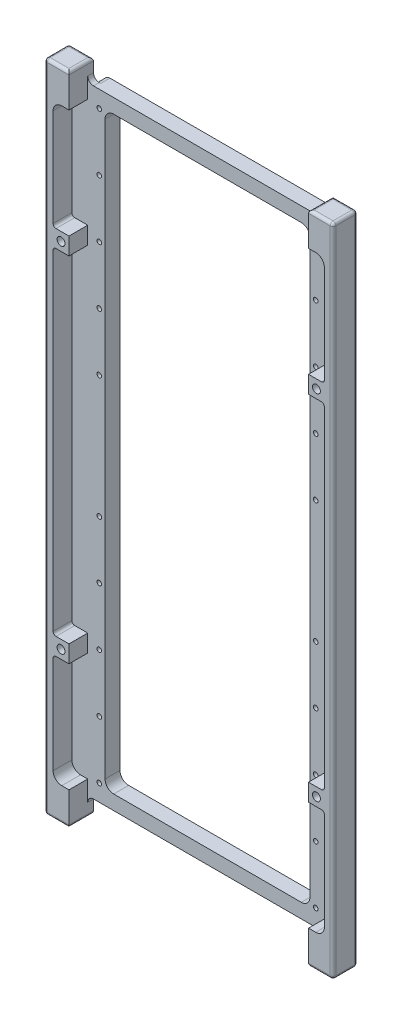
from build123d import *

# Parameters (mm, degrees)
SKETCH1_W             = 8.5
SKETCH1_H             = 8.5
BOSS_EXTRUDE1_DEPTH   = 227
SKETCH2_W             = 2
SKETCH2_H             = 214
BOSS_EXTRUDE2_DEPTH   = 50
BOSS_EXTRUDE3_DEPTH   = 3.18
CUT_EXTRUDE1_DEPTH    = 233.734660934
FILLET1_R             = 2
FILLET2_R             = 1
CUT_EXTRUDE2_DEPTH    = 6.5
M2X0_4_TAPPED_HOLE1_D = 1.6
SKETCH8_R             = 1.375
CUT_EXTRUDE3_DEPTH    = 233.596754062
SKETCH9_R             = 2.5
CUT_EXTRUDE4_DEPTH    = 4.75
LPATTERN1_COUNT       = 2
LPATTERN1_PITCH       = 88.5
LPATTERN1_COUNT_DIR2  = 2
LPATTERN1_PITCH_DIR2  = 122.4


with BuildPart() as part:
    # Sketch1 → Boss-Extrude1 (new body)
    with BuildSketch(Plane(origin=(0, 0, 0), x_dir=(1, 0, 0), z_dir=(0, 1, 0))):
        with Locations((45.75, 0)):
            Rectangle(SKETCH1_W, SKETCH1_H)
    boss_extrude1 = extrude(amount=BOSS_EXTRUDE1_DEPTH)

    # Sketch2 → Boss-Extrude2 (add)
    with BuildSketch(Plane.ZY.offset(-41.5)):
        with Locations((-3.25, 113.5)):
            Rectangle(SKETCH2_W, SKETCH2_H)
    boss_extrude2 = extrude(amount=BOSS_EXTRUDE2_DEPTH)

    # Mirror2: Boss-Extrude1, Boss-Extrude2 across plane
    add(boss_extrude1.mirror(Plane(origin=(0, 0, 0), x_dir=(0, 0, 1), z_dir=(1, 0, 0))))
    add(boss_extrude2.mirror(Plane(origin=(0, 0, 0), x_dir=(0, 0, 1), z_dir=(1, 0, 0))))

    # Sketch3 → Boss-Extrude3 (add)
    with BuildSketch(Plane(origin=(0, 0, -4.25), x_dir=(-1, 0, 0), z_dir=(0, 0, -1))):
        with BuildLine():
            Line((-39, 6.5), (39, 6.5))
            ThreePointArc((39, 6.5), (40.414213562, 7.085786438), (41, 8.5))
            Line((41, 8.5), (41, 218.5))
            ThreePointArc((41, 218.5), (40.414213562, 219.914213562), (39, 220.5))
            Line((39, 220.5), (-39, 220.5))
            ThreePointArc((-39, 220.5), (-40.414213562, 219.914213562), (-41, 218.5))
            Line((-41, 218.5), (-41, 8.5))
            ThreePointArc((-41, 8.5), (-40.414213562, 7.085786438), (-39, 6.5))
        make_face()
    extrude(amount=BOSS_EXTRUDE3_DEPTH)

    # Sketch4 → Cut-Extrude1 (cut, through all)
    with BuildSketch(Plane(origin=(0, 0, -7.43), x_dir=(-1, 0, 0), z_dir=(0, 0, -1))):
        with BuildLine():
            Line((-32.5, 11.5), (32.5, 11.5))
            ThreePointArc((32.5, 11.5), (34.621320344, 12.378679656), (35.5, 14.5))
            Line((35.5, 14.5), (35.5, 212.5))
            ThreePointArc((35.5, 212.5), (34.621320344, 214.621320344), (32.5, 215.5))
            Line((32.5, 215.5), (-32.5, 215.5))
            ThreePointArc((-32.5, 215.5), (-34.621320344, 214.621320344), (-35.5, 212.5))
            Line((-35.5, 212.5), (-35.5, 14.5))
            ThreePointArc((-35.5, 14.5), (-34.621320344, 12.378679656), (-32.5, 11.5))
        make_face()
    extrude(amount=-CUT_EXTRUDE1_DEPTH, mode=Mode.SUBTRACT)

    # Fillet1
    fillet1_edges = [part.edges().sort_by_distance(p)[0] for p in [
        (41.5, 6.5, -3.25),
        (-41.5, 6.5, -3.25),
        (41.5, 220.5, -3.25),
        (-41.5, 220.5, -3.25),
    ]]
    fillet(fillet1_edges, radius=FILLET1_R)

    # Fillet2
    fillet2_edges = [part.edges().sort_by_distance(p)[0] for p in [
        (50, 113.5, -4.25),
        (50, 113.5, 4.25),
        (-50, 113.5, -4.25),
        (-50, 113.5, 4.25),
        (45.75, 0, -4.25),
        (50, 0, 0),
        (45.75, 0, 4.25),
        (41.5, 0, 0),
        (-41.5, 0, 0),
        (-45.75, 0, -4.25),
        (-50, 0, 0),
        (-45.75, 0, 4.25),
        (45.75, 227, 4.25),
        (50, 227, 0),
        (45.75, 227, -4.25),
        (41.5, 227, 0),
        (-41.5, 227, 0),
        (-45.75, 227, -4.25),
        (-50, 227, 0),
        (-45.75, 227, 4.25),
    ]]
    fillet(fillet2_edges, radius=FILLET2_R)

    # Sketch5 → Cut-Extrude2 (cut)
    with BuildSketch(Plane.XY.offset(4.25)):
        with BuildLine():
            Line((-44, 11.5), (44, 11.5))
            ThreePointArc((44, 11.5), (46.121320344, 12.378679656), (47, 14.5))
            Line((47, 14.5), (47, 48.3))
            ThreePointArc((47, 48.3), (46.707106781, 49.007106781), (46, 49.3))
            Line((46, 49.3), (41.5, 49.3))
            Line((41.5, 49.3), (41.5, 55.3))
            Line((41.5, 55.3), (46, 55.3))
            ThreePointArc((46, 55.3), (46.707106781, 55.592893219), (47, 56.3))
            Line((47, 56.3), (47, 170.7))
            ThreePointArc((47, 170.7), (46.707106781, 171.407106781), (46, 171.7))
            Line((46, 171.7), (41.5, 171.7))
            Line((41.5, 171.7), (41.5, 177.7))
            Line((41.5, 177.7), (46, 177.7))
            ThreePointArc((46, 177.7), (46.707106781, 177.992893219), (47, 178.7))
            Line((47, 178.7), (47, 212.5))
            ThreePointArc((47, 212.5), (46.121320344, 214.621320344), (44, 215.5))
            Line((44, 215.5), (-44, 215.5))
            ThreePointArc((-44, 215.5), (-46.121320344, 214.621320344), (-47, 212.5))
            Line((-47, 212.5), (-47, 178.7))
            ThreePointArc((-47, 178.7), (-46.707106781, 177.992893219), (-46, 177.7))
            Line((-46, 177.7), (-41.5, 177.7))
            Line((-41.5, 177.7), (-41.5, 171.7))
            Line((-41.5, 171.7), (-46, 171.7))
            ThreePointArc((-46, 171.7), (-46.707106781, 171.407106781), (-47, 170.7))
            Line((-47, 170.7), (-47, 56.3))
            ThreePointArc((-47, 56.3), (-46.707106781, 55.592893219), (-46, 55.3))
            Line((-46, 55.3), (-41.5, 55.3))
            Line((-41.5, 55.3), (-41.5, 49.3))
            Line((-41.5, 49.3), (-46, 49.3))
            ThreePointArc((-46, 49.3), (-46.707106781, 49.007106781), (-47, 48.3))
            Line((-47, 48.3), (-47, 14.5))
            ThreePointArc((-47, 14.5), (-46.121320344, 12.378679656), (-44, 11.5))
        make_face()
    extrude(amount=-CUT_EXTRUDE2_DEPTH, mode=Mode.SUBTRACT)

    # M2x0.4 Tapped Hole1 (through all)
    with Locations(Plane(origin=(0, 0, -7.43), x_dir=(-1, 0, 0), z_dir=(0, 0, -1))):
        with Locations((-37.5, 214.7), (37.5, 214.7), (37.5, 194.7), (37.5, 174.7), (37.5, 154.7), (37.5, 134.7), (-37.5, 194.7), (-37.5, 174.7), (-37.5, 154.7), (-37.5, 134.7), (-37.5, 12.3), (-37.5, 32.3), (-37.5, 52.3), (-37.5, 72.3), (-37.5, 92.3), (37.5, 92.3), (37.5, 72.3), (37.5, 52.3), (37.5, 32.3), (37.5, 12.3)):
            Hole(M2X0_4_TAPPED_HOLE1_D / 2)

    # Sketch8 → Cut-Extrude3 (cut, through all)
    with BuildSketch(Plane(origin=(0, 0, -4.25), x_dir=(-1, 0, 0), z_dir=(0, 0, -1))):
        with Locations((-44.25, 174.7)):
            Circle(SKETCH8_R)
    cut_extrude3 = extrude(amount=-CUT_EXTRUDE3_DEPTH, mode=Mode.SUBTRACT)

    # Sketch9 → Cut-Extrude4 (cut)
    with BuildSketch(Plane(origin=(0, 0, -4.25), x_dir=(-1, 0, 0), z_dir=(0, 0, -1))):
        with Locations((-44.25, 174.7)):
            Circle(SKETCH9_R)
    cut_extrude4 = extrude(amount=-CUT_EXTRUDE4_DEPTH, mode=Mode.SUBTRACT)

    # LPattern1: Cut-Extrude3, Cut-Extrude4 2 × 2
    with Locations(*[(-i * LPATTERN1_PITCH, -j * LPATTERN1_PITCH_DIR2, 0) for i in range(LPATTERN1_COUNT) for j in range(LPATTERN1_COUNT_DIR2) if (i, j) != (0, 0)]):
        add(cut_extrude3, mode=Mode.SUBTRACT)
        add(cut_extrude4, mode=Mode.SUBTRACT)


solid = part.part
